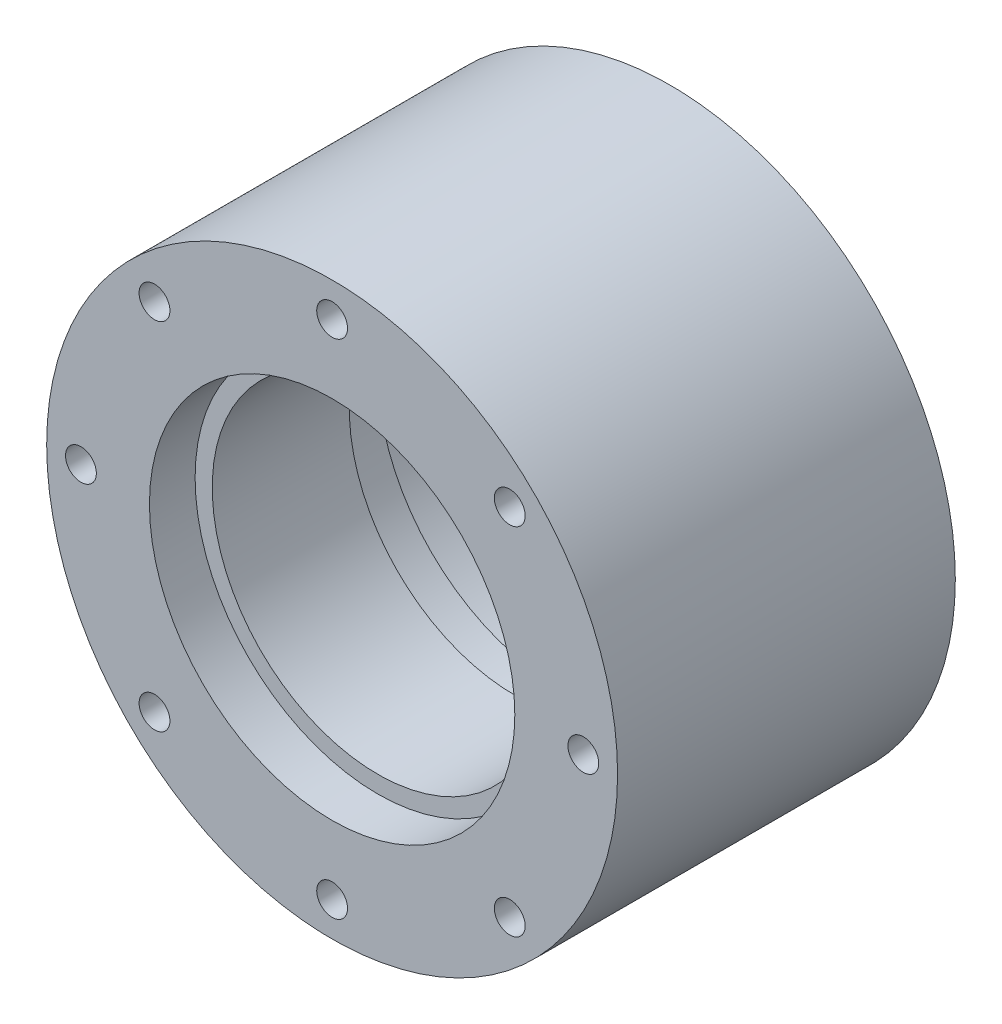
from build123d import *

# Parameters (mm, degrees)
SKETCH3_R          = 1.35
CUT_EXTRUDE2_DEPTH = 41.415051652
CUT_EXTRUDE4_START = -2.5
SKETCH4_R          = 2.25
CUT_EXTRUDE4_DEPTH = 44.120192023
CHAMFER1_SIZE      = 0.1
CIRPATTERN3_COUNT  = 4
CIRPATTERN2_COUNT  = 8


with BuildPart() as part:
    # Sketch7 → Revolve1 (revolve)
    with BuildSketch(Plane(origin=(0, 0, 0), x_dir=(1, 0, 0), z_dir=(0, 1, 0))):
        Polygon((16, 10), (16, 6), (14.5, 6), (14.5, -6), (16, -6), (16, -10), (25, -10), (25, 19.58), (19, 19.58), (19, 10), align=None)
    revolve(axis=Axis((0, 0, 11.479), (0, 0, -1)))

    # Sketch3 → Cut-Extrude2 (cut, symmetric)
    with BuildSketch(Plane.XY):
        with Locations((0, 22)):
            Circle(SKETCH3_R)
    cut_extrude2 = extrude(amount=CUT_EXTRUDE2_DEPTH, both=True, mode=Mode.SUBTRACT)

    # Sketch4 → Cut-Extrude4 (cut)
    with BuildSketch(Plane(origin=(0, 0, -10), x_dir=(-1, 0, 0), z_dir=(0, 0, -1)).offset(CUT_EXTRUDE4_START)):
        with Locations((0, 22)):
            Circle(SKETCH4_R)
    cut_extrude4 = extrude(amount=CUT_EXTRUDE4_DEPTH, mode=Mode.SUBTRACT)

    # Chamfer1
    chamfer1_edges = [part.edges().sort_by_distance(p)[0] for p in [
        (-1.35, 22, -7.5),
    ]]
    chamfer(chamfer1_edges, length=CHAMFER1_SIZE)

    # CirPattern3: Cut-Extrude4 ×4 about axis
    cirpattern3_axis = Axis((0, 0, 11.479), (0, 0, -1))
    for i in range(1, CIRPATTERN3_COUNT):
        add(cut_extrude4.rotate(cirpattern3_axis, i * 360 / CIRPATTERN3_COUNT), mode=Mode.SUBTRACT)

    # CirPattern2: Cut-Extrude2 ×8 about axis
    cirpattern2_axis = Axis((0, 0, 11.479), (0, 0, -1))
    for i in range(1, CIRPATTERN2_COUNT):
        add(cut_extrude2.rotate(cirpattern2_axis, i * 360 / CIRPATTERN2_COUNT), mode=Mode.SUBTRACT)


solid = part.part
